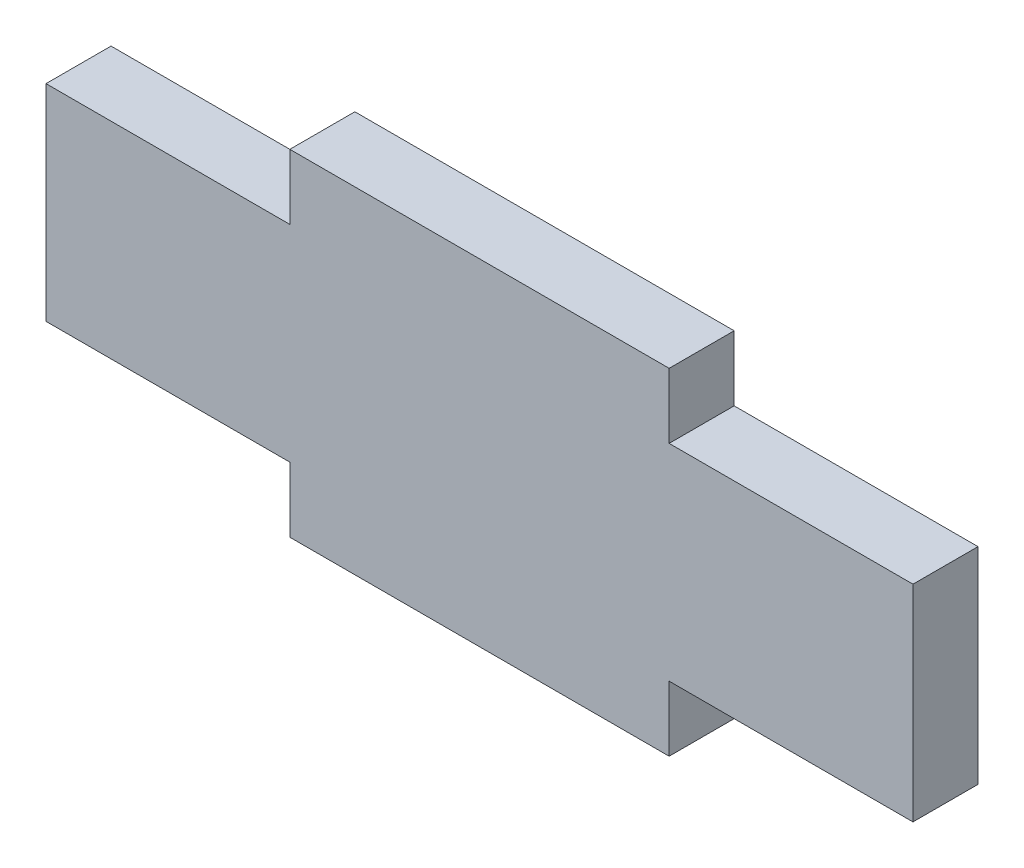
from build123d import *

# Parameters (mm, degrees)
RESSALTO_EXTRUS_O1_DEPTH = 6


with BuildPart() as part:
    # Esboço1 → Ressalto-extrusão1 (new body)
    with BuildSketch(Plane.XY):
        Polygon((-40, 9.5), (-40, -9.5), (-17.5, -9.5), (-17.5, -15.5), (17.5, -15.5), (17.5, -9.5), (40, -9.5), (40, 9.5), (17.5, 9.5), (17.5, 15.5), (-17.5, 15.5), (-17.5, 9.5), align=None)
    extrude(amount=RESSALTO_EXTRUS_O1_DEPTH)


solid = part.part
